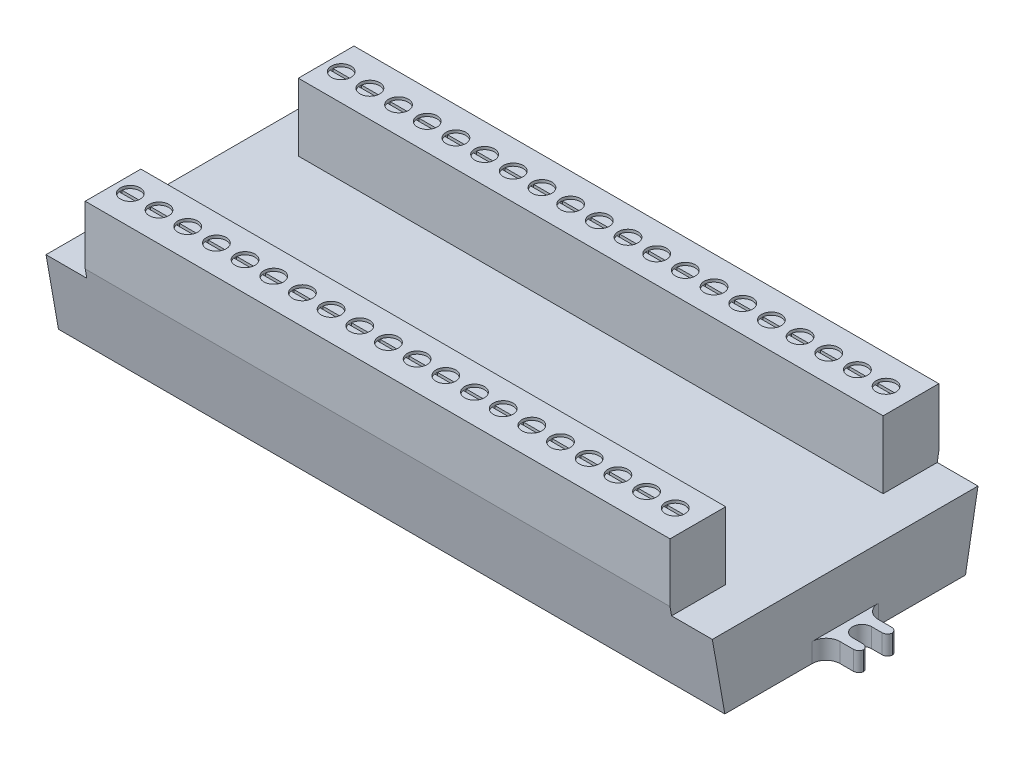
from build123d import *

# Parameters (mm, degrees)
SKETCH1_W              = 118.5
SKETCH1_H              = 47.8
BOSS_EXTRUDE1_DEPTH    = 12.3
BOSS_EXTRUDE2_DEPTH    = 3.4
FILLET1_R              = 1
FILLET1_OF_MIRROR2_R   = 1
FILLET2_R              = 2.5
SKETCH4_W              = 185.233724777
SKETCH4_H              = 28
CUT_EXTRUDE1_DEPTH     = 12
CHAMFER1_SIZE          = 2.5
CHAMFER1_SIZE2         = 14.178204549
CUT_EXTRUDE2_START     = -12
CUT_EXTRUDE2_OUTLINE_W = 7.25
CUT_EXTRUDE2_OUTLINE_H = 9.9
CUT_EXTRUDE2_DEPTH     = 12
SKETCH6_R              = 1.75
CUT_EXTRUDE3_DEPTH     = 0.5
SKETCH7_W              = 3.464101615
SKETCH7_H              = 0.5
CUT_EXTRUDE4_DEPTH     = 0.5
LPATTERN1_COUNT        = 20
LPATTERN1_PITCH        = 5.1
LPATTERN1_COUNT_DIR2   = 2
LPATTERN1_PITCH_DIR2   = 37.5


# Read off the part's stored shape, not the designer's step: Cut-Extrude2
with BuildPart() as part:
    # Sketch1 → Boss-Extrude1 (new, symmetric)
    with BuildSketch(Plane(origin=(0, 0, 0), x_dir=(1, 0, 0), z_dir=(0, 1, 0))):
        Rectangle(SKETCH1_W, SKETCH1_H)
    extrude(amount=BOSS_EXTRUDE1_DEPTH, both=True)

    # Sketch2 → Boss-Extrude2 (add)
    with BuildSketch(Plane.XZ.offset(12.3)):
        with BuildLine():
            Line((0, 3.4), (0, -3.4))
            Line((0, -3.4), (-65.1, -3.4))
            Line((-65.1, -3.4), (-65.1, -1.7))
            Line((-65.1, -1.7), (-62.25, -1.7))
            ThreePointArc((-62.25, -1.7), (-60.55, 0), (-62.25, 1.7))
            Line((-62.25, 1.7), (-65.1, 1.7))
            Line((-65.1, 1.7), (-65.1, 3.4))
            Line((-65.1, 3.4), (0, 3.4))
        make_face()
    boss_extrude2 = extrude(amount=-BOSS_EXTRUDE2_DEPTH)

    # Fillet1
    # the kernel refuses this fillet: 1 mm, written as the material it takes off along each edge
    with BuildSketch(Plane(origin=(-65.1, -14.8, 3.4), x_dir=(1, 0, 0), z_dir=(0, 1, 0)), Plane(origin=(-65.1, -14.8, 1.7), x_dir=(0, 0, 1), z_dir=(0, 1, 0))) as fillet1_piece_1:
        with BuildLine():
            CenterArc((FILLET1_R, FILLET1_R), FILLET1_R, 180, 90)
            Line((0, FILLET1_R), (0, 0))
            Line((0, 0), (FILLET1_R, 0))
        make_face()
    extrude(amount=8.4, mode=Mode.SUBTRACT)
    with BuildSketch(Plane(origin=(-65.1, -14.8, -1.7), x_dir=(0, 0, -1), z_dir=(0, 1, 0)), Plane(origin=(-65.1, -14.8, -3.4), x_dir=(1, 0, 0), z_dir=(0, 1, 0))) as fillet1_piece_2:
        with BuildLine():
            CenterArc((FILLET1_R, -FILLET1_R), FILLET1_R, 90, 90)
            Line((0, -FILLET1_R), (0, 0))
            Line((0, 0), (FILLET1_R, 0))
        make_face()
    extrude(amount=8.4, mode=Mode.SUBTRACT)

    # Mirror2: Boss-Extrude2 across plane
    add(boss_extrude2.mirror(Plane(origin=(0, 0, 0), x_dir=(0, 0, 1), z_dir=(1, 0, 0))))

    # Fillet1 of Mirror2
    # the kernel refuses this fillet: 1 mm, written as the material it takes off along each edge
    with BuildSketch(Plane(origin=(65.1, -14.8, 3.4), x_dir=(-1, 0, 0), z_dir=(0, 1, 0)), Plane(origin=(65.1, -14.8, 1.7), x_dir=(0, 0, 1), z_dir=(0, 1, 0)), Plane(origin=(65.1, -14.8, -1.7), x_dir=(-1, 0, 0), z_dir=(0, 1, 0))) as fillet1_of_mirror2_piece_1:
        with BuildLine():
            CenterArc((FILLET1_OF_MIRROR2_R, -FILLET1_OF_MIRROR2_R), FILLET1_OF_MIRROR2_R, 90, 90)
            Line((0, -FILLET1_OF_MIRROR2_R), (0, 0))
            Line((0, 0), (FILLET1_OF_MIRROR2_R, 0))
        make_face()
    extrude(amount=8.4, mode=Mode.SUBTRACT)
    with BuildSketch(Plane(origin=(65.1, -14.8, -3.4), x_dir=(-1, 0, 0), z_dir=(0, 1, 0))) as fillet1_of_mirror2_piece_2:
        with BuildLine():
            CenterArc((FILLET1_OF_MIRROR2_R, FILLET1_OF_MIRROR2_R), FILLET1_OF_MIRROR2_R, 180, 90)
            Line((0, FILLET1_OF_MIRROR2_R), (0, 0))
            Line((0, 0), (FILLET1_OF_MIRROR2_R, 0))
        make_face()
    extrude(amount=8.4, mode=Mode.SUBTRACT)

    # Fillet2
    fillet2_edges = [part.edges().sort_by_distance(p)[0] for p in [
        (-59.25, -10.6, 3.4),
        (-59.25, -10.6, -3.4),
        (59.25, -10.6, -3.4),
        (59.25, -10.6, 3.4),
    ]]
    fillet(fillet2_edges, radius=FILLET2_R)

    # Sketch4 → Cut-Extrude1 (cut)
    with BuildSketch(Plane(origin=(0, 12.3, 0), x_dir=(1, 0, 0), z_dir=(0, 1, 0))):
        with Locations((2.016657487, 0)):
            Rectangle(SKETCH4_W, SKETCH4_H)
    extrude(amount=-CUT_EXTRUDE1_DEPTH, mode=Mode.SUBTRACT)

    # Chamfer1
    chamfer1_edges = [part.edges().sort_by_distance(p)[0] for p in [
        (0, -12.3, -23.9),
        (0, -12.3, 23.9),
    ]]
    chamfer1_side = [part.faces().sort_by_distance(p)[0] for p in [
        (0, -12.3, 0),
    ]]
    chamfer(chamfer1_edges, length=CHAMFER1_SIZE, length2=CHAMFER1_SIZE2, reference=chamfer1_side[0])

    # Cut-Extrude2 outline → Cut-Extrude2 (cut)
    with BuildSketch(Plane(origin=(0, 12.3, 0), x_dir=(1, 0, 0), z_dir=(0, 1, 0)).offset(CUT_EXTRUDE2_START)):
        with Locations((55.625, 18.95)):
            Rectangle(CUT_EXTRUDE2_OUTLINE_W, CUT_EXTRUDE2_OUTLINE_H)
        with Locations((-55.625, 18.95)):
            Rectangle(CUT_EXTRUDE2_OUTLINE_W, CUT_EXTRUDE2_OUTLINE_H)
        with Locations((55.625, -18.95)):
            Rectangle(CUT_EXTRUDE2_OUTLINE_W, CUT_EXTRUDE2_OUTLINE_H)
        with Locations((-55.625, -18.95)):
            Rectangle(CUT_EXTRUDE2_OUTLINE_W, CUT_EXTRUDE2_OUTLINE_H)
    extrude(amount=CUT_EXTRUDE2_DEPTH, mode=Mode.SUBTRACT)

    # Sketch6 → Cut-Extrude3 (cut)
    with BuildSketch(Plane(origin=(0, 12.3, 0), x_dir=(1, 0, 0), z_dir=(0, 1, 0))):
        with Locations(Location((-49.183656038, 18.810859978, 0), (0, 0, 270))):
            Circle(SKETCH6_R)
    cut_extrude3 = extrude(amount=-CUT_EXTRUDE3_DEPTH, mode=Mode.SUBTRACT)

    # Sketch7 → Cut-Extrude4 (cut)
    with BuildSketch(Plane(origin=(0, 11.8, 0), x_dir=(1, 0, 0), z_dir=(0, 1, 0))):
        with Locations((-49.183656039, 18.810859978)):
            Rectangle(SKETCH7_W, SKETCH7_H)
    cut_extrude4 = extrude(amount=-CUT_EXTRUDE4_DEPTH, mode=Mode.SUBTRACT)

    # LPattern1: Cut-Extrude3, Cut-Extrude4 20 × 2
    with Locations(*[(i * LPATTERN1_PITCH, 0, j * LPATTERN1_PITCH_DIR2) for i in range(LPATTERN1_COUNT) for j in range(LPATTERN1_COUNT_DIR2) if (i, j) != (0, 0)]):
        add(cut_extrude3, mode=Mode.SUBTRACT)
        add(cut_extrude4, mode=Mode.SUBTRACT)


solid = part.part
